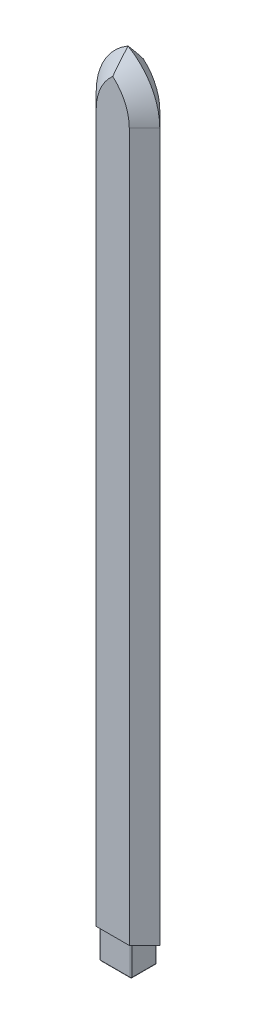
from build123d import *

# Parameters (mm, degrees)
BOSS_EXTRUDE1_DEPTH = 6.096
CHAMFER1_SIZE       = 6.096
SKETCH2_W           = 12.7
SKETCH2_H           = 10.16
BOSS_EXTRUDE2_DEPTH = 12.192
FILLET2_R           = 0.381
SKETCH3_R           = 4.7625
CUT_EXTRUDE1_DEPTH  = 292.1


with BuildPart() as part:
    # Sketch1 → Boss-Extrude1 (new, symmetric)
    with BuildSketch(Plane.XY):
        with BuildLine():
            Line((-12.7, 0), (-12.7, 282.8036))
            ThreePointArc((-12.7, 282.8036), (-9.297045256, 295.5036), (0, 304.800645256))
            ThreePointArc((0, 304.800645256), (9.297045256, 295.5036), (12.7, 282.8036))
            Line((12.7, 282.8036), (12.7, 0))
            Line((12.7, 0), (-12.7, 0))
        make_face()
    extrude(amount=BOSS_EXTRUDE1_DEPTH, both=True)

    # Chamfer1
    chamfer1_edges = [part.edges().sort_by_distance(p)[0] for p in [
        (-9.297045256, 295.5036, -6.096),
        (-12.7, 141.4018, -6.096),
        (-9.297045256, 295.5036, 6.096),
        (-12.7, 141.4018, 6.096),
        (9.297045256, 295.5036, 6.096),
        (12.7, 141.4018, 6.096),
        (9.297045256, 295.5036, -6.096),
        (12.7, 141.4018, -6.096),
    ]]
    chamfer(chamfer1_edges, length=CHAMFER1_SIZE - 0.0001)  # a hair under: the kernel refuses the full size

    # Sketch2 → Boss-Extrude2 (add)
    with BuildSketch(Plane.XZ):
        Rectangle(SKETCH2_W, SKETCH2_H)
    extrude(amount=BOSS_EXTRUDE2_DEPTH)

    # Fillet2
    fillet2_edges = [part.edges().sort_by_distance(p)[0] for p in [
        (6.35, 0, 0),
        (6.35, -6.096, -5.08),
        (0, 0, 5.08),
        (6.35, -6.096, 5.08),
        (-6.35, 0, 0),
        (-6.35, -6.096, 5.08),
        (0, 0, -5.08),
        (-6.35, -6.096, -5.08),
        (6.35, -12.192, 0),
        (0, -12.192, 5.08),
        (-6.35, -12.192, 0),
        (0, -12.192, -5.08),
    ]]
    fillet(fillet2_edges, radius=FILLET2_R)

    # Sketch3 → Cut-Extrude1 (cut)
    with BuildSketch(Plane.XZ.offset(12.192)):
        with Locations(Location((0, 0, 0), (0, 0, 270))):
            Circle(SKETCH3_R)
    extrude(amount=-CUT_EXTRUDE1_DEPTH, mode=Mode.SUBTRACT)


solid = part.part
